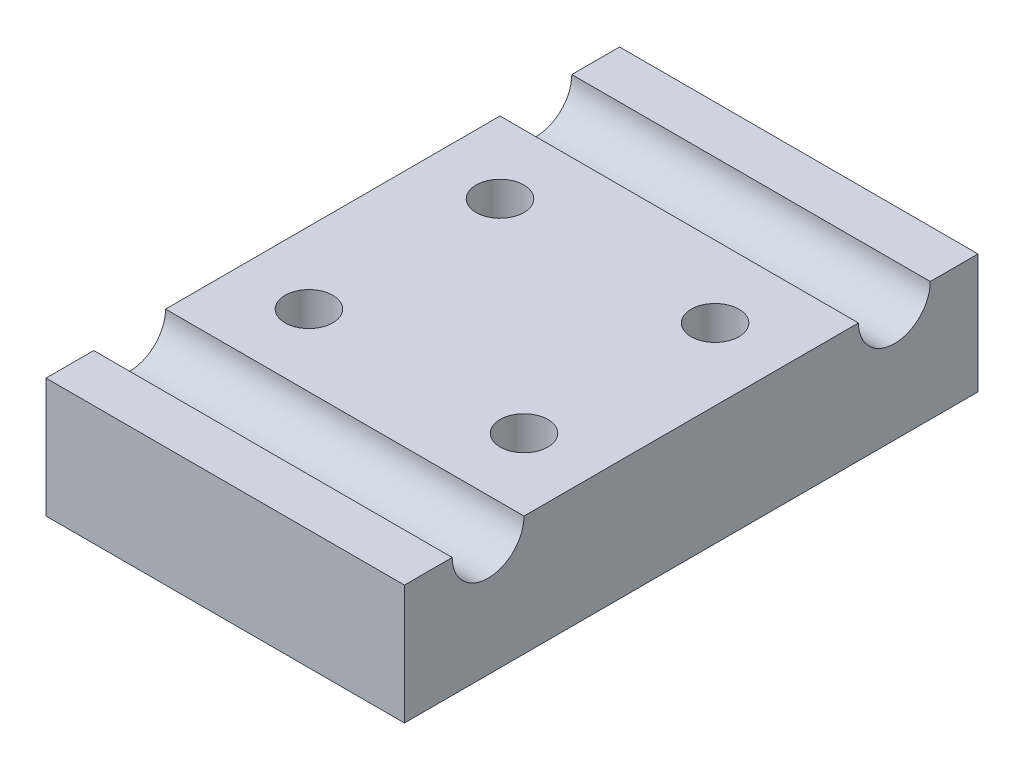
from build123d import *

# Parameters (mm, degrees)
SKETCH_1_W          = 30
SKETCH_1_H          = 10
EXTRUDE_1_DEPTH     = 48
SKETCH_3_R          = 3.005
CUT_EXTRUDE_1_DEPTH = 48
SKETCH_4_R          = 2
CUT_EXTRUDE_2_DEPTH = 58.480431453


with BuildPart() as part:
    # 草图1 → 凸台-拉伸1 (new body)
    with BuildSketch(Plane.XY):
        with Locations((15, 5)):
            Rectangle(SKETCH_1_W, SKETCH_1_H)
    extrude(amount=EXTRUDE_1_DEPTH)

    # 草图3 → 切除-拉伸1 (cut)
    with BuildSketch(Plane.ZY):
        with Locations((7, 10)):
            Circle(SKETCH_3_R)
        with Locations((41, 10)):
            Circle(SKETCH_3_R)
    extrude(amount=-CUT_EXTRUDE_1_DEPTH, mode=Mode.SUBTRACT)

    # 草图4 → 切除-拉伸2 (cut, through all)
    with BuildSketch(Plane(origin=(0, 10, 0), x_dir=(1, 0, 0), z_dir=(0, 1, 0))):
        with Locations((24, -31.995)):
            Circle(SKETCH_4_R)
        with Locations((6, -31.995)):
            Circle(SKETCH_4_R)
        with Locations((24, -16.005)):
            Circle(SKETCH_4_R)
        with Locations((6, -16.005)):
            Circle(SKETCH_4_R)
    extrude(amount=-CUT_EXTRUDE_2_DEPTH, mode=Mode.SUBTRACT)


solid = part.part
